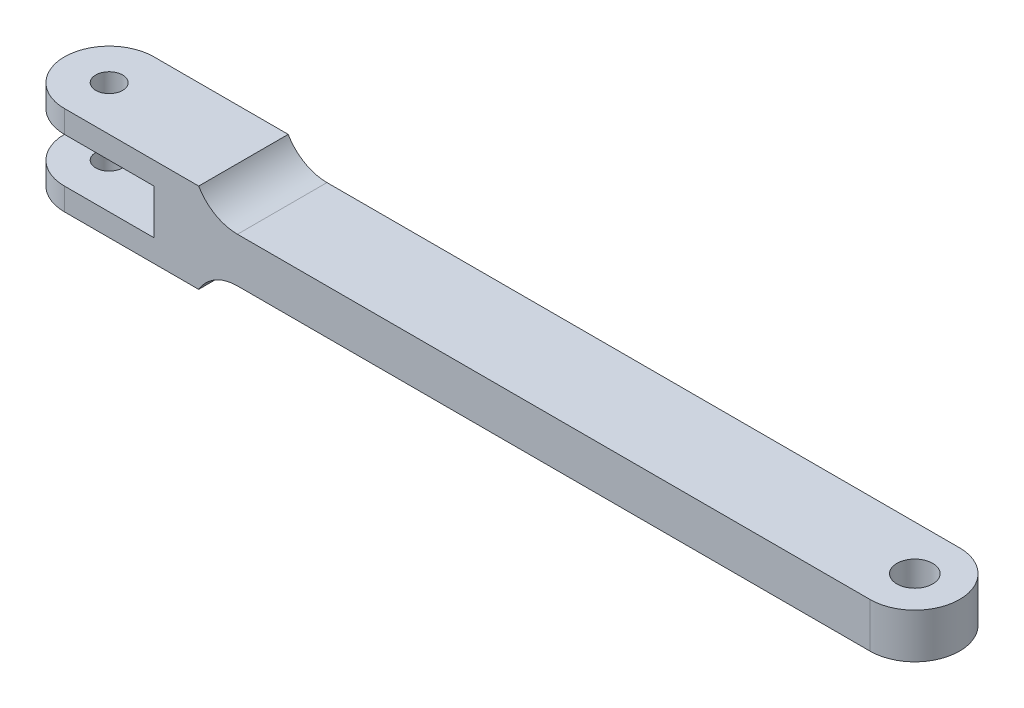
from build123d import *

# Parameters (mm, degrees)
SALIENTE_EXTRUIR1_DEPTH = 10
CROQUIS2_R              = 1.5
CORTAR_EXTRUIR1_DEPTH   = 10
CROQUIS3_W              = 15
CROQUIS3_H              = 2.5
CORTAR_EXTRUIR2_DEPTH   = 10
CROQUIS4_R              = 1.5
CORTAR_EXTRUIR3_DEPTH   = 10
CORTAR_EXTRUIR5_DEPTH   = 10
CROQUIS9_R              = 2
SALIENTE_EXTRUIR2_DEPTH = 2.5
CROQUIS10_W             = 80
CROQUIS10_H             = 16.68210675
CROQUIS10_H_2           = 15.952607418
CORTAR_EXTRUIR6_DEPTH   = 10
REDONDEO1_R             = 5


with BuildPart() as part:
    # Croquis1 → Saliente-Extruir1 (new body)
    with BuildSketch(Plane.XY):
        Polygon((0, 0), (105, 0), (105, 2.5), (105, 7.5), (105, 10), (0, 10), (0, 7.5), (15, 7.5), (15, 2.5), (0, 2.5), align=None)
    extrude(amount=SALIENTE_EXTRUIR1_DEPTH)

    # Croquis2 → Cortar-Extruir1 (cut)
    with BuildSketch(Plane(origin=(0, 10, 0), x_dir=(1, 0, 0), z_dir=(0, 1, 0))):
        with Locations(Location((5, -5, 0), (0, 0, 270))):
            Circle(CROQUIS2_R)
        with BuildLine():
            Line((-4.031911586, 0), (5, 0))
            ThreePointArc((5, 0), (0, -5), (5, -10))
            Line((5, -10), (-4.031911586, -10))
            Line((-4.031911586, -10), (-4.031911586, 0))
        make_face()
    extrude(amount=-CORTAR_EXTRUIR1_DEPTH, mode=Mode.SUBTRACT)

    # Croquis3 → Cortar-Extruir2 (cut)
    with BuildSketch(Plane(origin=(0, 10, 0), x_dir=(1, 0, 0), z_dir=(0, 1, 0))):
        with Locations((97.5, -1.25)):
            Rectangle(CROQUIS3_W, CROQUIS3_H)
        with Locations((97.5, -8.75)):
            Rectangle(CROQUIS3_W, CROQUIS3_H)
    extrude(amount=-CORTAR_EXTRUIR2_DEPTH, mode=Mode.SUBTRACT)

    # Croquis4 → Cortar-Extruir3 (cut)
    with BuildSketch(Plane.XY.offset(7.5)):
        with Locations((100, 5)):
            Circle(CROQUIS4_R)
        with BuildLine():
            Line((100, 10), (171.112400038, 10))
            Line((171.112400038, 10), (171.112400038, 0))
            Line((171.112400038, 0), (100, 0))
            ThreePointArc((100, 0), (105, 5), (100, 10))
        make_face()
    extrude(amount=-CORTAR_EXTRUIR3_DEPTH, mode=Mode.SUBTRACT)

    # Croquis8 → Cortar-Extruir5 (cut)
    with BuildSketch(Plane.XY.offset(7.5)):
        with BuildLine():
            Line((90, 0), (100, 0))
            ThreePointArc((100, 0), (105, 5), (100, 10))
            Line((100, 10), (90, 10))
            Line((90, 10), (90, 0))
        make_face()
    extrude(amount=-CORTAR_EXTRUIR5_DEPTH, mode=Mode.SUBTRACT)

    # Croquis9 → Saliente-Extruir2 (add, symmetric)
    with BuildSketch(Plane(origin=(0, 5, 0), x_dir=(-1, 0, 0), z_dir=(0, -1, 0))):
        with BuildLine():
            Line((-90, -10), (-95, -10))
            ThreePointArc((-95, -10), (-100, -5), (-95, 0))
            Line((-95, 0), (-90, 0))
            Line((-90, 0), (-90, -10))
        make_face()
        with Locations(Location((-95, -5, 0), (0, 0, 90))):
            Circle(CROQUIS9_R, mode=Mode.SUBTRACT)
    extrude(amount=SALIENTE_EXTRUIR2_DEPTH, both=True)

    # Croquis10 → Cortar-Extruir6 (cut)
    with BuildSketch(Plane(origin=(0, 0, 0), x_dir=(-1, 0, 0), z_dir=(0, 0, -1))):
        with Locations((-60, 15.841053375)):
            Rectangle(CROQUIS10_W, CROQUIS10_H)
        with Locations((-60, -5.476303709)):
            Rectangle(CROQUIS10_W, CROQUIS10_H_2)
    extrude(amount=-CORTAR_EXTRUIR6_DEPTH, mode=Mode.SUBTRACT)

    # Redondeo1
    # the kernel refuses this fillet: 5 mm, written as the material it adds along each edge
    with BuildSketch(Plane(origin=(20, 2.5, 0), x_dir=(1, 0, 0), z_dir=(0, 0, 1))) as redondeo1_piece_1:
        with BuildLine():
            CenterArc((4.330127019, -5), REDONDEO1_R, 90, 60)
            Line((0, -2.5), (-0.08660254, -2.45))
            ThreePointArc((-0.08660254, -2.45), (-0.1, -1.25), (-0.1, 0))
            Line((-0.1, 0), (0, 0.1))
            Line((0, 0.1), (4.330127019, 0.1))
            Line((4.330127019, 0.1), (4.330127019, 0))
        make_face()
    extrude(amount=10)
    with BuildSketch(Plane(origin=(20, 7.5, 0), x_dir=(0, 1, 0), z_dir=(0, 0, 1))) as redondeo1_piece_2:
        with BuildLine():
            CenterArc((5, -4.330127019), REDONDEO1_R, 120, 60)
            Line((0, -4.330127019), (-0.1, -4.330127019))
            Line((-0.1, -4.330127019), (-0.1, 0))
            Line((-0.1, 0), (0, 0.1))
            ThreePointArc((0, 0.1), (1.25, 0.1), (2.45, 0.08660254))
            Line((2.45, 0.08660254), (2.5, 0))
        make_face()
    extrude(amount=10)


solid = part.part
